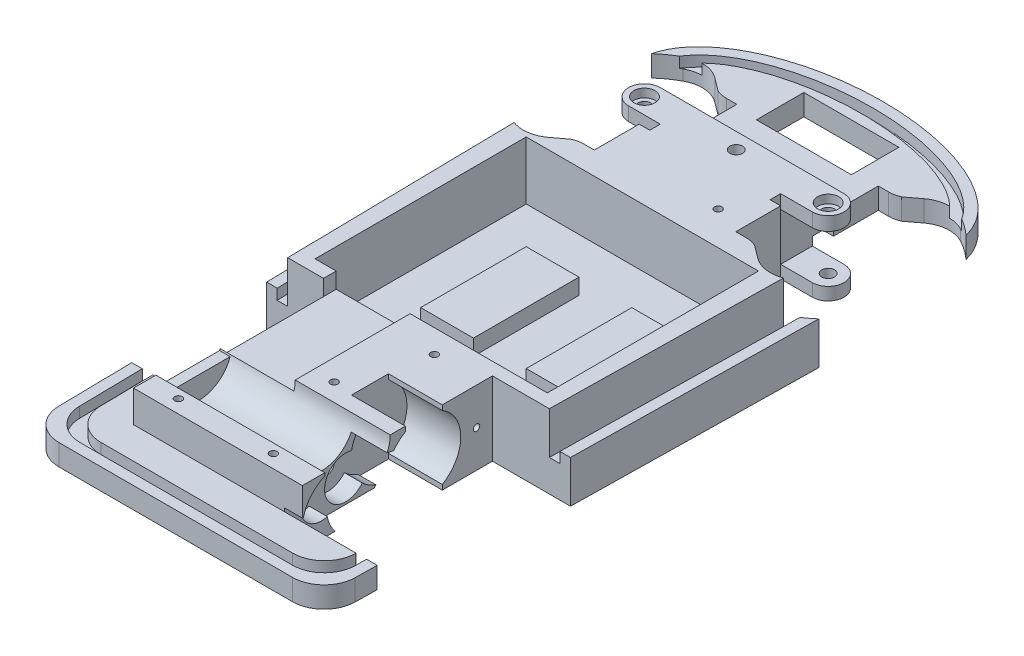
from build123d import *
from build123d.topology import SkipClean

# Parameters (mm, degrees)
SKETCH_1_RX               = 15
SKETCH_1_RY               = 8
EXTRUDE_1_DEPTH           = 2
FILLET_1_R                = 3
CUT_EXTRUDE_1_DEPTH       = 69.687699069
SKETCH_3_R                = 0.6
CUT_EXTRUDE_2_DEPTH       = 72.196910082
SKETCH_4_W                = 6
SKETCH_4_H                = 13
CUT_EXTRUDE_3_DEPTH       = 69.687699069
EXTRUDE_START             = -3.5
SKETCH_5_W                = 11
SKETCH_5_H                = 13
SKETCH_5_W_2              = 1
EXTRUDE_2_DEPTH           = 5
SKETCH_6_R                = 1.25
CUT_EXTRUDE_4_DEPTH       = 72.254824432
EXTRUDE_START_2           = 3
SKETCH_8_W                = 11
SKETCH_8_H                = 4
EXTRUDE_4_DEPTH           = 8
CUT_EXTRUDE_6_REACH       = 73.344
SKETCH_10_R               = 3.1
CUT_EXTRUDE_START         = -17
SKETCH_11_W               = 9
SKETCH_11_H               = 4
CUT_EXTRUDE_7_DEPTH       = 17
EXTRUDE_START_3           = -2.8
EXTRUDE_5_DEPTH           = 0.4
EXTRUDE_START_4           = -7.8
EXTRUDE_6_DEPTH           = 0.4
SKETCH_14_R               = 0.6
CUT_EXTRUDE_8_DEPTH       = 69.84039514
CUT_EXTRUDE_9_DEPTH       = 69.84039514
FILLET_3_R                = 2.5
FILLET_4_R                = 3
SKETCH_16_R               = 0.6
SKETCH_16_W               = 2
SKETCH_16_H               = 1
SKETCH_16_W_2             = 1
CUT_EXTRUDE_10_DEPTH      = 69.81610203
EXTRUDE_7_DEPTH           = 3
EXTRUDE_7_DEPTH_BACK      = 5
SKETCH_16_3_W             = 11.4
SKETCH_16_3_H             = 3
SKETCH_16_3_R             = 0.6
EXTRUDE_START_5           = 0.8
SKETCH_16_4_R             = 0.6
EXTRUDE_8_DEPTH           = 2.2
EXTRUDE_START_6           = -5
SKETCH_16_5_R             = 0.6
EXTRUDE_9_DEPTH           = 1.3
CUT_EXTRUDE_START_2       = 2
CUT_EXTRUDE_12_DEPTH      = 1
FILLET_5_R                = 3
EXTRUDE_START_7           = 1.5
EXTRUDE_10_DEPTH          = 1.5
EXTRUDE_11_DEPTH          = 1.5
EXTRUDE_12_DEPTH          = 2
SKETCH_19_W               = 22
SKETCH_19_H               = 20
CUT_EXTRUDE_13_DEPTH      = 4
SKETCH_21_R               = 0.5
SKETCH_21_W               = 5
SKETCH_21_H               = 10
CUT_EXTRUDE_14_DEPTH      = 1.5
SKETCH_26_W               = 9
SKETCH_26_H               = 4.5
CUT_EXTRUDE_18_DEPTH      = 69.81610203
SKETCH_30_W               = 4.4
SKETCH_30_H               = 1.086541276
SKETCH_30_H_2             = 1
CUT_EXTRUDE_22_DEPTH      = 69.750679259
CUT_EXTRUDE_START_3       = -1.5
CUT_EXTRUDE_23_DEPTH      = 1.5
SKETCH_32_W               = 7
SKETCH_32_H               = 13
EXTRUDE_13_DEPTH          = 7
SKETCH_32_3_W             = 11
SKETCH_32_3_H             = 9
EXTRUDE_14_DEPTH          = 5.5
EXTRUDE_START_8           = -9
EXTRUDE_15_DEPTH          = 17
EXTRUDE_16_DEPTH          = 3
CUT_EXTRUDE_24_DEPTH      = 54.937147668
CUT_EXTRUDE_24_DEPTH_BACK = 54.937147668
SKETCH_33_W               = 29.563747264
SKETCH_33_H               = 3
SKETCH_34_R               = 0.75
CUT_EXTRUDE_25_DEPTH      = 72.306675189
SKETCH_38_R               = 0.35
CUT_EXTRUDE_35_DEPTH      = 3
SKETCH_40_R               = 1
CUT_EXTRUDE_37_DEPTH      = 0.8
SKETCH_36_R               = 3.1
CUT_EXTRUDE_38_DEPTH      = 17
SKETCH_36_16_R            = 0.6
CUT_EXTRUDE_39_DEPTH      = 10
SKETCH_36_17_R            = 0.6
CUT_EXTRUDE_40_DEPTH      = 10
SKETCH_36_20_W            = 2.120465053
SKETCH_36_20_H            = 7
SKETCH_36_20_W_2          = 15.879534947
CUT_EXTRUDE_41_DEPTH      = 7.1
EXTRUDE_START_9           = -5.4
SKETCH_36_23_R            = 0.6
EXTRUDE_21_DEPTH          = 1.7
EXTRUDE_START_10          = -3.7
EXTRUDE_24_DEPTH          = 1.7
SKETCH_36_33_W            = 2.120465053
SKETCH_36_33_H            = 7
SKETCH_36_33_W_2          = 15.879534947
CUT_EXTRUDE_43_DEPTH      = 72.306675189
EXTRUDE_29_DEPTH          = 1.7
CUT_EXTRUDE_44_DEPTH      = 71.977924041
SKETCH_28_R               = 0.35
CUT_EXTRUDE_45_DEPTH      = 69.990259447
SKETCH_42_W               = 7
SKETCH_42_H               = 11
CUT_EXTRUDE_46_DEPTH      = 1.5
SKETCH_43_R               = 0.3
CUT_EXTRUDE_47_DEPTH      = 4


with BuildPart() as part:
    # 草图1 → 凸台-拉伸1 (new body)
    with BuildSketch(Plane(origin=(0, 0, 0), x_dir=(1, 0, 0), z_dir=(0, 1, 0))):
        with Locations(Location((0, -8), (0, 0, 180))):
            Ellipse(SKETCH_1_RX, SKETCH_1_RY)
        Polygon((-15, -8), (15, -8), (14, -67), (-14, -67), align=None)
    extrude(amount=EXTRUDE_1_DEPTH)

    # 圆角1
    fillet_1_edges = [part.edges().sort_by_distance(p)[0] for p in [
        (-14, 1, 67),
        (14, 1, 67),
    ]]
    fillet(fillet_1_edges, radius=FILLET_1_R)

    # 草图2 → 切除-拉伸1 (cut, through all)
    with BuildSketch(Plane(origin=(0, 2, 0), x_dir=(1, 0, 0), z_dir=(0, 1, 0))):
        Polygon((-9, -57), (-9, -44), (-14.389830508, -44), (-14.169491525, -57), align=None)
        Polygon((14.389830508, -44), (9, -44), (9, -57), (14.169491525, -57), align=None)
    extrude(amount=-CUT_EXTRUDE_1_DEPTH, mode=Mode.SUBTRACT)

    # 草图3 → 切除-拉伸2 (cut, through all)
    with BuildSketch(Plane.ZY.offset(9)):
        with Locations((50.5, 1)):
            Circle(SKETCH_3_R)
    extrude(amount=-CUT_EXTRUDE_2_DEPTH, mode=Mode.SUBTRACT)

    # 草图4 → 切除-拉伸3 (cut, through all)
    with BuildSketch(Plane(origin=(0, 2, 0), x_dir=(1, 0, 0), z_dir=(0, 1, 0))):
        with Locations((5, -50.5)):
            Rectangle(SKETCH_4_W, SKETCH_4_H)
    extrude(amount=-CUT_EXTRUDE_3_DEPTH, mode=Mode.SUBTRACT)

    # 草图5 → 凸台-拉伸2 (add)
    with BuildSketch(Plane(origin=(0, 2, 0), x_dir=(1, 0, 0), z_dir=(0, 1, 0)).offset(EXTRUDE_START)):
        with Locations((-3.5, -50.5)):
            Rectangle(SKETCH_5_W, SKETCH_5_H)
        with Locations((8.5, -50.5)):
            Rectangle(SKETCH_5_W_2, SKETCH_5_H)
    extrude(amount=EXTRUDE_2_DEPTH)

    # 草图6 → 切除-拉伸4 (cut, through all)
    with BuildSketch(Plane.ZY.offset(9)):
        with Locations((50.5, 1)):
            Circle(SKETCH_6_R)
    extrude(amount=-CUT_EXTRUDE_4_DEPTH, mode=Mode.SUBTRACT)

    # 草图8 → 凸台-拉伸4 (add)
    with BuildSketch(Plane.XZ.offset(EXTRUDE_START_2)):
        Polygon((2, 57), (9, 57), (9, 62), (-9, 62), (-9, 57), align=None)
        with Locations((-3.5, 55)):
            Rectangle(SKETCH_8_W, SKETCH_8_H)
    extrude(amount=-EXTRUDE_4_DEPTH)

    # 切除-拉伸6: up to this face of the body (flat: up to its plane)
    cut_extrude_6_end = Plane(part.part.faces().sort_by_distance((8, 1, 56.860716117))[0])
    # 草图10 → 切除-拉伸6 (cut, up to the picked face)
    with BuildSketch(Plane.ZY.offset(9), mode=Mode.PRIVATE) as cut_extrude_6_sk1:
        with Locations(Location((57, 1, 0), (0, 0, 18.819063369))):
            Circle(SKETCH_10_R)
    cut_extrude_6_tool1 = split(extrude(cut_extrude_6_sk1.sketch, amount=-CUT_EXTRUDE_6_REACH, mode=Mode.PRIVATE), bisect_by=cut_extrude_6_end, keep=Keep.BOTH, mode=Mode.PRIVATE)
    add(cut_extrude_6_tool1.solids().sort_by(Axis((-9, 1, 57), (1, 0, 0)))[0], mode=Mode.SUBTRACT)

    # 草图11 → 切除-拉伸7 (cut)
    with BuildSketch(Plane.ZY.offset(9).offset(CUT_EXTRUDE_START)):
        with Locations((57.5, -1)):
            Rectangle(SKETCH_11_W, SKETCH_11_H)
    extrude(amount=CUT_EXTRUDE_7_DEPTH, mode=Mode.SUBTRACT)

    # 草图12 → 凸台-拉伸5 (add)
    with BuildSketch(Plane.ZY.offset(9).offset(EXTRUDE_START_3)):
        with BuildLine():
            ThreePointArc((59.93428015, 2), (56.493180735, 4.058289429), (53.9, 1))
            Line((53.9, 1), (54, 1))
            ThreePointArc((54, 1), (57, 4), (60, 1))
            Line((60, 1), (60.2, 1))
            ThreePointArc((60.2, 1), (60.159680194, 1.506380362), (60.039736831, 2))
            Line((60.039736831, 2), (59.93428015, 2))
        make_face()
    extrude(amount=-EXTRUDE_5_DEPTH)

    # 草图12<3> → 凸台-拉伸6 (add)
    with BuildSketch(Plane.ZY.offset(9).offset(EXTRUDE_START_4)):
        with BuildLine():
            ThreePointArc((54, 1), (57, 4), (60, 1))
            Line((60, 1), (60.2, 1))
            ThreePointArc((60.2, 1), (57, 4.2), (53.8, 1))
            Line((53.8, 1), (54, 1))
        make_face()
    extrude(amount=-EXTRUDE_6_DEPTH)

    # 草图14 → 切除-拉伸8 (cut, through all)
    with BuildSketch(Plane(origin=(0, 2, 0), x_dir=(1, 0, 0), z_dir=(0, 1, 0))):
        with Locations(Location((0, -13.9, 0), (0, 0, 270))):
            Circle(SKETCH_14_R)
        with Locations(Location((-8.7, -13.9, 0), (0, 0, 270))):
            Circle(SKETCH_14_R)
        with Locations(Location((8.7, -13.9, 0), (0, 0, 270))):
            Circle(SKETCH_14_R)
    extrude(amount=-CUT_EXTRUDE_8_DEPTH, mode=Mode.SUBTRACT)

    # 草图15 → 切除-拉伸9 (cut, through all)
    with BuildSketch(Plane(origin=(0, 2, 0), x_dir=(1, 0, 0), z_dir=(0, 1, 0))):
        with BuildLine():
            Line((-8.7, -7.15), (-8.7, -4.65))
            ThreePointArc((-8.7, -4.65), (-17.95, -13.9), (-8.7, -23.15))
            Line((-8.7, -23.15), (-8.7, -20.65))
            Line((-8.7, -20.65), (-6.7, -20.65))
            Line((-6.7, -20.65), (-6.7, -15.4))
            Line((-6.7, -15.4), (-8.7, -15.4))
            ThreePointArc((-8.7, -15.4), (-10.2, -13.9), (-8.7, -12.4))
            Line((-8.7, -12.4), (-6.7, -12.4))
            Line((-6.7, -12.4), (-6.7, -7.15))
            Line((-6.7, -7.15), (-8.7, -7.15))
        make_face()
        with BuildLine():
            Line((8.7, -4.65), (8.7, -7.15))
            Line((8.7, -7.15), (6.7, -7.15))
            Line((6.7, -7.15), (6.7, -12.4))
            Line((6.7, -12.4), (8.7, -12.4))
            ThreePointArc((8.7, -12.4), (10.2, -13.899999995), (8.700000009, -15.4))
            Line((8.700000009, -15.4), (6.7, -15.4))
            Line((6.7, -15.4), (6.7, -20.65))
            Line((6.7, -20.65), (8.7, -20.65))
            Line((8.7, -20.65), (8.7, -23.15))
            ThreePointArc((8.7, -23.15), (17.95, -13.9), (8.7, -4.65))
        make_face()
    extrude(amount=-CUT_EXTRUDE_9_DEPTH, mode=Mode.SUBTRACT)

    # Chamfer 2
    # the kernel refuses this chamfer: 2 mm, written as the material it adds along each edge
    with BuildSketch(Plane(origin=(-8.7, 2, 4.65), x_dir=(0, 0, 1), z_dir=(0, -1, 0)), Plane(origin=(8.7, 2, 23.15), x_dir=(0, 0, -1), z_dir=(0, -1, 0))) as chamfer_2_piece_1:
        with BuildLine():
            Line((2.329457801, -0.063896468), (0.31078787, 2.615620606))
            Line((0.31078787, 2.615620606), (0.272339981, 2.626655089))
            ThreePointArc((0.272339981, 2.626655089), (0.054587771, 1.322306295), (-0.04, 0))
            Line((-0.04, 0), (0, -0.04))
            ThreePointArc((0, -0.04), (1.164728901, -0.04), (2.329457801, -0.103896468))
            Line((2.329457801, -0.103896468), (2.329457801, -0.063896468))
        make_face()
    extrude(amount=2)
    with BuildSketch(Plane(origin=(-8.7, 2, 23.15), x_dir=(-0.9902517942555952, 0, -0.13928885085883316), z_dir=(0, -1, 0)), Plane(origin=(8.7, 2, 4.65), x_dir=(0.9902517942555955, 0, 0.13928885085883175), z_dir=(0, -1, 0))) as chamfer_2_piece_2:
        with BuildLine():
            Line((2.633412283, -0.056568542), (0.261193908, 2.315649833))
            Line((0.261193908, 2.315649833), (0.221583836, 2.321221387))
            ThreePointArc((0.221583836, 2.321221387), (0.122623678, 1.158946438), (-0.039610072, 0.005571554))
            Line((-0.039610072, 0.005571554), (-0.005571554, -0.039610072))
            ThreePointArc((-0.005571554, -0.039610072), (1.317019649, -0.130126886), (2.638983837, -0.096178614))
            Line((2.638983837, -0.096178614), (2.633412283, -0.056568542))
        make_face()
    extrude(amount=2)

    # 圆角3
    # the kernel refuses this fillet: 2.5 mm, written as the material it takes off along each edge
    with BuildSketch(Plane(origin=(-8.7, 4.556338628, 7.15), x_dir=(1, 0, 0), z_dir=(0, -1, 0)), Plane(origin=(8.7, 4.556338628, 20.65), x_dir=(-1, 0, 0), z_dir=(0, -1, 0))) as fillet_3_piece_1:
        with BuildLine():
            CenterArc((1.022535451, -2.5), FILLET_3_R, 90, 24.142922194)
            Line((0, -0.218679932), (0, 0))
            Line((0, 0), (1.022535451, 0))
        make_face()
    extrude(amount=7.112677256, mode=Mode.SUBTRACT)
    with BuildSketch(Plane(origin=(-8.7, 4.556338628, 20.65), x_dir=(0, 0, 1), z_dir=(0, -1, 0)), Plane(origin=(8.7, 4.556338628, 7.15), x_dir=(0, 0, -1), z_dir=(0, -1, 0))) as fillet_3_piece_2:
        with BuildLine():
            CenterArc((2.5, -1.022535451), FILLET_3_R, 155.857077806, 24.142922194)
            Line((0, -1.022535451), (0, 0))
            Line((0, 0), (0.218679932, 0))
        make_face()
    extrude(amount=7.112677256, mode=Mode.SUBTRACT)

    # 圆角4
    fillet_4_edges = [part.edges().sort_by_distance(p)[0] for p in [
        (11.251724138, 1, 5.008925604),
        (11.251724138, 1, 22.791074396),
        (-11.251724138, 1, 22.791074396),
        (-11.251724138, 1, 5.008925604),
    ]]
    fillet(fillet_4_edges, radius=FILLET_4_R)

    # 草图16 → 切除-拉伸10 (cut, through all)
    with SkipClean():  # the faces are left unmerged after this step: merging them gives an invalid solid
        with BuildSketch(Plane.XZ):
            with Locations((-8.7, 13.9)):
                Circle(SKETCH_16_R)
            with BuildLine():
                Line((-8.7, 15.4), (-8.7, 12.4))
                ThreePointArc((-8.7, 12.4), (-10.2, 13.9), (-8.7, 15.4))
            make_face()
            with BuildLine():
                ThreePointArc((-8.1, 13.9), (-8.275735931, 14.324264069), (-8.7, 14.5))
                Line((-8.7, 14.5), (-8.7, 13.3))
                ThreePointArc((-8.7, 13.3), (-8.275735931, 13.475735931), (-8.1, 13.9))
            make_face()
            with BuildLine():
                Line((-8.7, 13.3), (-8.7, 14.5))
                ThreePointArc((-8.7, 14.5), (-9.3, 13.9), (-8.7, 13.3))
            make_face()
            with BuildLine():
                ThreePointArc((-7.2, 13.9), (-7.639339828, 14.960660172), (-8.7, 15.4))
                Line((-8.7, 15.4), (-8.7, 14.5))
                ThreePointArc((-8.7, 14.5), (-8.275735931, 14.324264069), (-8.1, 13.9))
                ThreePointArc((-8.1, 13.9), (-8.275735931, 13.475735931), (-8.7, 13.3))
                Line((-8.7, 13.3), (-8.7, 12.4))
                ThreePointArc((-8.7, 12.4), (-7.639339828, 12.839339828), (-7.2, 13.9))
            make_face()
            with BuildLine():
                Line((-8.7, 14.5), (-8.7, 15.4))
                ThreePointArc((-8.7, 15.4), (-10.2, 13.9), (-8.7, 12.4))
                Line((-8.7, 12.4), (-8.7, 13.3))
                ThreePointArc((-8.7, 13.3), (-9.3, 13.9), (-8.7, 14.5))
            make_face()
            with Locations((-7.7, 15.9)):
                Rectangle(SKETCH_16_W, SKETCH_16_H)
            with Locations((-6.2, 15.9)):
                Rectangle(SKETCH_16_W_2, SKETCH_16_H)
            with BuildLine():
                Line((-6.7, 15.4), (-8.7, 15.4))
                ThreePointArc((-8.7, 15.4), (-7.639339828, 14.960660172), (-7.2, 13.9))
                ThreePointArc((-7.2, 13.9), (-7.639339828, 12.839339828), (-8.7, 12.4))
                Line((-8.7, 12.4), (-6.7, 12.4))
                Line((-6.7, 12.4), (-5.7, 12.4))
                Line((-5.7, 12.4), (-5.7, 15.4))
                Line((-5.7, 15.4), (-6.7, 15.4))
            make_face()
            with Locations((-6.2, 11.9)):
                Rectangle(SKETCH_16_W_2, SKETCH_16_H)
            with Locations((-7.7, 11.9)):
                Rectangle(SKETCH_16_W, SKETCH_16_H)
            with Locations((7.7, 15.9)):
                Rectangle(SKETCH_16_W, SKETCH_16_H)
            with Locations((6.2, 15.9)):
                Rectangle(SKETCH_16_W_2, SKETCH_16_H)
            with BuildLine():
                Line((6.7, 15.4), (5.7, 15.4))
                Line((5.7, 15.4), (5.7, 12.4))
                Line((5.7, 12.4), (6.7, 12.4))
                Line((6.7, 12.4), (8.7, 12.4))
                ThreePointArc((8.7, 12.4), (7.2, 13.9), (8.7, 15.4))
                Line((8.7, 15.4), (6.7, 15.4))
            make_face()
            with Locations((6.2, 11.9)):
                Rectangle(SKETCH_16_W_2, SKETCH_16_H)
            with Locations((7.7, 11.9)):
                Rectangle(SKETCH_16_W, SKETCH_16_H)
            with BuildLine():
                ThreePointArc((10.2, 13.9), (9.760660172, 14.960660172), (8.7, 15.4))
                Line((8.7, 15.4), (8.7, 14.5))
                ThreePointArc((8.7, 14.5), (9.124264069, 14.324264069), (9.3, 13.9))
                ThreePointArc((9.3, 13.9), (9.124264069, 13.475735931), (8.7, 13.3))
                Line((8.7, 13.3), (8.7, 12.4))
                ThreePointArc((8.7, 12.4), (9.760660172, 12.839339828), (10.2, 13.9))
            make_face()
            with BuildLine():
                Line((8.7, 14.5), (8.7, 15.4))
                ThreePointArc((8.7, 15.4), (7.2, 13.9), (8.7, 12.4))
                Line((8.7, 12.4), (8.7, 13.3))
                ThreePointArc((8.7, 13.3), (8.1, 13.9), (8.7, 14.5))
            make_face()
            with BuildLine():
                ThreePointArc((9.3, 13.9), (9.124264069, 14.324264069), (8.7, 14.5))
                Line((8.7, 14.5), (8.7, 13.3))
                ThreePointArc((8.7, 13.3), (9.124264069, 13.475735931), (9.3, 13.9))
            make_face()
            with BuildLine():
                Line((8.7, 13.3), (8.7, 14.5))
                ThreePointArc((8.7, 14.5), (8.1, 13.9), (8.7, 13.3))
            make_face()
            with Locations((8.7, 13.9)):
                Circle(SKETCH_16_R)
            with BuildLine():
                Line((8.7, 15.4), (8.7, 12.4))
                ThreePointArc((8.7, 12.4), (10.2, 13.9), (8.7, 15.4))
            make_face()
        extrude(amount=-CUT_EXTRUDE_10_DEPTH, mode=Mode.SUBTRACT)

    # 草图16<3> → 凸台-拉伸7 (add, two sides: drawn at the far end of the back side and taken through both)
    with SkipClean():  # the faces are left unmerged after this step: merging them gives an invalid solid
        with BuildSketch(Plane.XZ.offset(-EXTRUDE_7_DEPTH_BACK)):
            with Locations((0, 13.9)):
                Rectangle(SKETCH_16_3_W, SKETCH_16_3_H)
            with Locations((0, 13.9)):
                Circle(SKETCH_16_3_R, mode=Mode.SUBTRACT)
        extrude(amount=EXTRUDE_7_DEPTH + EXTRUDE_7_DEPTH_BACK)

    # 草图16<4> → 凸台-拉伸8 (add)
    # profile 1 of 2: a face of its own
    with SkipClean():  # the faces are left unmerged after this step: merging them gives an invalid solid
        with BuildSketch(Plane.XZ.offset(EXTRUDE_START_5)):
            with BuildLine():
                Line((-8.7, 12.4), (-5.7, 12.4))
                Line((-5.7, 12.4), (-5.7, 15.4))
                Line((-5.7, 15.4), (-8.7, 15.4))
                ThreePointArc((-8.7, 15.4), (-10.2, 13.9), (-8.7, 12.4))
            make_face()
            with Locations(Location((-8.7, 13.9, 0), (0, 0, 270))):
                Circle(SKETCH_16_4_R, mode=Mode.SUBTRACT)
        # profile 2 of 2: a face of its own
        with BuildSketch(Plane.XZ.offset(EXTRUDE_START_5)):
            with BuildLine():
                Line((8.7, 15.4), (5.7, 15.4))
                Line((5.7, 15.4), (5.7, 12.4))
                Line((5.7, 12.4), (8.7, 12.4))
                ThreePointArc((8.7, 12.4), (10.2, 13.9), (8.7, 15.4))
            make_face()
            with Locations(Location((8.7, 13.9, 0), (0, 0, 270))):
                Circle(SKETCH_16_4_R, mode=Mode.SUBTRACT)
        extrude(amount=EXTRUDE_8_DEPTH)

    # 草图16<5> → 凸台-拉伸9 (add)
    # profile 1 of 2: a face of its own
    with SkipClean():  # the faces are left unmerged after this step: merging them gives an invalid solid
        with BuildSketch(Plane.XZ.offset(EXTRUDE_START_6)):
            with BuildLine():
                Line((-8.7, 12.4), (-5.7, 12.4))
                Line((-5.7, 12.4), (-5.7, 15.4))
                Line((-5.7, 15.4), (-8.7, 15.4))
                ThreePointArc((-8.7, 15.4), (-10.2, 13.9), (-8.7, 12.4))
            make_face()
            with Locations(Location((-8.7, 13.9, 0), (0, 0, 270))):
                Circle(SKETCH_16_5_R, mode=Mode.SUBTRACT)
        # profile 2 of 2: a face of its own
        with BuildSketch(Plane.XZ.offset(EXTRUDE_START_6)):
            with BuildLine():
                Line((8.7, 15.4), (5.7, 15.4))
                Line((5.7, 15.4), (5.7, 12.4))
                Line((5.7, 12.4), (8.7, 12.4))
                ThreePointArc((8.7, 12.4), (10.2, 13.9), (8.7, 15.4))
            make_face()
            with Locations(Location((8.7, 13.9, 0), (0, 0, 270))):
                Circle(SKETCH_16_5_R, mode=Mode.SUBTRACT)
        extrude(amount=EXTRUDE_9_DEPTH)

    # 草图1<6> → 切除-拉伸12 (cut)
    with SkipClean():  # the faces are left unmerged after this step: merging them gives an invalid solid
        with BuildSketch(Plane(origin=(0, 0, 0), x_dir=(1, 0, 0), z_dir=(0, 1, 0)).offset(CUT_EXTRUDE_START_2)):
            with BuildLine():
                add(Edge.make_bspline(
                    [(-13.9501652, -10.940253215), (-13.521853712, -11.5182851), (-12.931286453, -12.054099249)],
                    knots=[0.376353518, 0.376353518, 0.376353518, 0.531425091, 0.531425091, 0.531425091], degree=2, weights=[1, 0.996995606, 1]))
                Line((-13.9501652, -10.940253215), (-13.016949153, -66))
                Line((-13.016949153, -66), (0, -66))
                Line((0, -66), (0, -65))
                Line((0, -65), (-12.033898305, -65))
                Line((-12.033898305, -65), (-12.931286453, -12.054099249))
            make_face()
            with BuildLine():
                Line((0, -65), (0, -66))
                Line((0, -66), (13.016949153, -66))
                Line((13.016949153, -66), (13.9501652, -10.940253215))
                add(Edge.make_bspline(
                    [(12.931286453, -12.054099249), (13.521853712, -11.5182851), (13.9501652, -10.940253215)],
                    knots=[2.610167562, 2.610167562, 2.610167562, 2.765239136, 2.765239136, 2.765239136], degree=2, weights=[1, 0.996995606, 1]))
                Line((12.931286453, -12.054099249), (12.033898305, -65))
                Line((12.033898305, -65), (0, -65))
            make_face()
            with BuildLine():
                Line((13.9501652, -10.940253215), (13.997989228, -8.118635548))
                add(Edge.make_bspline(
                    [(12.955022923, -10.65364754), (13.953357105, -9.435188605), (13.997989228, -8.118635548)],
                    knots=[5.894369902, 5.894369902, 5.894369902, 6.26623656, 6.26623656, 6.26623656], degree=2, weights=[1, 0.98276414, 1]))
                Line((12.955022923, -10.65364754), (12.931286453, -12.054099249))
                add(Edge.make_bspline(
                    [(12.931286453, -12.054099249), (13.521853712, -11.5182851), (13.9501652, -10.940253215)],
                    knots=[2.610167562, 2.610167562, 2.610167562, 2.765239136, 2.765239136, 2.765239136], degree=2, weights=[1, 0.996995606, 1]))
            make_face()
            with BuildLine():
                Line((13.997989228, -8.118635548), (14, -8))
                Line((14, -8), (13, -8))
                add(Edge.make_bspline(
                    [(12.998409043, -8.093866485), (13, -8.046936115), (13, -8)],
                    knots=[6.267540255, 6.267540255, 6.267540255, 6.283185307, 6.283185307, 6.283185307], degree=2, weights=[1, 0.999969404, 1]))
                Line((12.998409043, -8.093866485), (12.955022923, -10.65364754))
                add(Edge.make_bspline(
                    [(12.955022923, -10.65364754), (13.953357105, -9.435188605), (13.997989228, -8.118635548)],
                    knots=[5.894369902, 5.894369902, 5.894369902, 6.26623656, 6.26623656, 6.26623656], degree=2, weights=[1, 0.98276414, 1]))
            make_face()
            with BuildLine():
                add(Edge.make_bspline(
                    [(0, -1), (-14, -1), (-14, -8)],
                    knots=[1.570796327, 1.570796327, 1.570796327, 3.141592654, 3.141592654, 3.141592654], degree=2, weights=[1, 0.707106781, 1]))
                Line((-14, -8), (-13, -8))
                add(Edge.make_bspline(
                    [(0, -2), (-13, -2), (-13, -8)],
                    knots=[1.570796327, 1.570796327, 1.570796327, 3.141592654, 3.141592654, 3.141592654], degree=2, weights=[1, 0.707106781, 1]))
                Line((0, -2), (0, -1))
            make_face()
            with BuildLine():
                add(Edge.make_bspline(
                    [(14, -8), (14, -1), (0, -1)],
                    knots=[0, 0, 0, 1.570796327, 1.570796327, 1.570796327], degree=2, weights=[1, 0.707106781, 1]))
                Line((0, -1), (0, -2))
                add(Edge.make_bspline(
                    [(13, -8), (13, -2), (0, -2)],
                    knots=[0, 0, 0, 1.570796327, 1.570796327, 1.570796327], degree=2, weights=[1, 0.707106781, 1]))
                Line((13, -8), (14, -8))
            make_face()
            with BuildLine():
                Line((-13, -8), (-14, -8))
                Line((-14, -8), (-13.997989228, -8.118635548))
                add(Edge.make_bspline(
                    [(-13.997989228, -8.118635548), (-13.953357105, -9.435188605), (-12.955022923, -10.65364754)],
                    knots=[3.1585414, 3.1585414, 3.1585414, 3.530408058, 3.530408058, 3.530408058], degree=2, weights=[1, 0.98276414, 1]))
                Line((-12.955022923, -10.65364754), (-12.998409043, -8.093866485))
                add(Edge.make_bspline(
                    [(-13, -8), (-13, -8.046936115), (-12.998409043, -8.093866485)],
                    knots=[3.141592654, 3.141592654, 3.141592654, 3.157237706, 3.157237706, 3.157237706], degree=2, weights=[1, 0.999969404, 1]))
            make_face()
            with BuildLine():
                add(Edge.make_bspline(
                    [(-13.997989228, -8.118635548), (-13.953357105, -9.435188605), (-12.955022923, -10.65364754)],
                    knots=[3.1585414, 3.1585414, 3.1585414, 3.530408058, 3.530408058, 3.530408058], degree=2, weights=[1, 0.98276414, 1]))
                Line((-13.997989228, -8.118635548), (-13.9501652, -10.940253215))
                add(Edge.make_bspline(
                    [(-13.9501652, -10.940253215), (-13.521853712, -11.5182851), (-12.931286453, -12.054099249)],
                    knots=[0.376353518, 0.376353518, 0.376353518, 0.531425091, 0.531425091, 0.531425091], degree=2, weights=[1, 0.996995606, 1]))
                Line((-12.931286453, -12.054099249), (-12.955022923, -10.65364754))
            make_face()
        extrude(amount=-CUT_EXTRUDE_12_DEPTH, mode=Mode.SUBTRACT)

    # 圆角5
    fillet_5_edges = [part.edges().sort_by_distance(p)[0] for p in [
        (-13.016949153, 1.5, 66),
        (12.033898305, 1.5, 65),
        (13.016949153, 1.5, 66),
        (-12.033898305, 1.5, 65),
    ]]
    fillet(fillet_5_edges, radius=FILLET_5_R)

    # 草图17 → 凸台-拉伸10 (add)
    with SkipClean():  # the faces are left unmerged after this step: merging them gives an invalid solid
        with BuildSketch(Plane(origin=(0, 2, 0), x_dir=(1, 0, 0), z_dir=(0, 1, 0)).offset(EXTRUDE_START_7)):
            with BuildLine():
                Line((8, -44), (9, -44))
                Line((9, -44), (12.389830508, -44))
                Line((12.389830508, -44), (12.759521181, -22.188250328))
                ThreePointArc((12.759521181, -22.188250328), (11.278098241, -22.347687368), (9.9026815, -21.774745061))
                Line((9.9026815, -21.774745061), (8.7, -20.868679932))
                ThreePointArc((8.7, -20.868679932), (8.200293312, -20.705281185), (7.677464549, -20.65))
                Line((7.677464549, -20.65), (6.7, -20.65))
                Line((6.7, -20.65), (6.7, -16.4))
                Line((6.7, -16.4), (5.7, -16.4))
                Line((5.7, -16.4), (5.7, -15.4))
                Line((5.7, -15.4), (-5.7, -15.4))
                Line((-5.7, -15.4), (-5.7, -16.4))
                Line((-5.7, -16.4), (-6.7, -16.4))
                Line((-6.7, -16.4), (-6.7, -20.65))
                Line((-6.7, -20.65), (-7.677464549, -20.65))
                ThreePointArc((-7.677464549, -20.65), (-8.200293312, -20.705281185), (-8.7, -20.868679932))
                Line((-8.7, -20.868679932), (-9.9026815, -21.774745061))
                ThreePointArc((-9.9026815, -21.774745061), (-11.278098241, -22.347687368), (-12.759521181, -22.188250328))
                Line((-12.759521181, -22.188250328), (-12.389830508, -44))
                Line((-12.389830508, -44), (-9, -44))
                Line((-9, -44), (2, -44))
                Line((2, -44), (8, -44))
            make_face()
        extrude(amount=-EXTRUDE_10_DEPTH)

    # 草图18 → 凸台-拉伸11 (add)
    with BuildSketch(Plane(origin=(0, 3.5, 0), x_dir=(1, 0, 0), z_dir=(0, 1, 0)).offset(EXTRUDE_START_7)):
        with BuildLine():
            Line((-9, -44), (-9, -53))
            Line((-9, -53), (2, -53))
            Line((2, -53), (2, -44))
            Line((2, -44), (8, -44))
            Line((8, -44), (8, -57))
            Line((8, -57), (9, -57))
            Line((9, -57), (9, -44))
            Line((9, -44), (12.389830508, -44))
            Line((12.389830508, -44), (12.759521181, -22.188250328))
            ThreePointArc((12.759521181, -22.188250328), (11.278098241, -22.347687368), (9.9026815, -21.774745061))
            Line((9.9026815, -21.774745061), (8.7, -20.868679932))
            ThreePointArc((8.7, -20.868679932), (8.200293312, -20.705281185), (7.677464549, -20.65))
            Line((7.677464549, -20.65), (6.7, -20.65))
            Line((6.7, -20.65), (6.7, -16.4))
            Line((6.7, -16.4), (5.7, -16.4))
            Line((5.7, -16.4), (5.7, -15.4))
            Line((5.7, -15.4), (-5.7, -15.4))
            Line((-5.7, -15.4), (-5.7, -16.4))
            Line((-5.7, -16.4), (-6.7, -16.4))
            Line((-6.7, -16.4), (-6.7, -20.65))
            Line((-6.7, -20.65), (-7.677464549, -20.65))
            ThreePointArc((-7.677464549, -20.65), (-8.200293312, -20.705281185), (-8.7, -20.868679932))
            Line((-8.7, -20.868679932), (-9.9026815, -21.774745061))
            ThreePointArc((-9.9026815, -21.774745061), (-11.278098241, -22.347687368), (-12.759521181, -22.188250328))
            Line((-12.759521181, -22.188250328), (-12.389830508, -44))
            Line((-12.389830508, -44), (-9, -44))
        make_face()
    extrude(amount=-EXTRUDE_11_DEPTH)

    # 草图22 → 凸台-拉伸12 (add)
    with BuildSketch(Plane.XZ):
        with BuildLine():
            Line((-5.7, 15.4), (5.7, 15.4))
            Line((5.7, 15.4), (5.7, 16.4))
            Line((5.7, 16.4), (6.7, 16.4))
            Line((6.7, 16.4), (6.7, 20.65))
            Line((6.7, 20.65), (7.677464549, 20.65))
            ThreePointArc((7.677464549, 20.65), (8.200293312, 20.705281185), (8.7, 20.868679932))
            Line((8.7, 20.868679932), (9.9026815, 21.774745061))
            ThreePointArc((9.9026815, 21.774745061), (11.492678535, 22.370901353), (13.151612826, 22.008368717))
            ThreePointArc((13.151612826, 22.008368717), (13.99743947, 21.482851381), (14.781873632, 20.869455727))
            Line((14.781873632, 20.869455727), (14.389830508, 44))
            Line((14.389830508, 44), (9, 44))
            Line((9, 44), (8, 44))
            Line((8, 44), (2, 44))
            Line((2, 44), (-9, 44))
            Line((-9, 44), (-14.389830508, 44))
            Line((-14.389830508, 44), (-14.781873632, 20.869455727))
            ThreePointArc((-14.781873632, 20.869455727), (-13.99743947, 21.482851381), (-13.151612826, 22.008368717))
            ThreePointArc((-13.151612826, 22.008368717), (-11.492678535, 22.370901353), (-9.9026815, 21.774745061))
            Line((-9.9026815, 21.774745061), (-8.7, 20.868679932))
            ThreePointArc((-8.7, 20.868679932), (-8.200293312, 20.705281185), (-7.677464549, 20.65))
            Line((-7.677464549, 20.65), (-6.7, 20.65))
            Line((-6.7, 20.65), (-6.7, 16.4))
            Line((-6.7, 16.4), (-5.7, 16.4))
            Line((-5.7, 16.4), (-5.7, 15.4))
        make_face()
    extrude(amount=EXTRUDE_12_DEPTH)

    # 草图19 → 切除-拉伸13 (cut)
    with BuildSketch(Plane(origin=(0, 5, 0), x_dir=(1, 0, 0), z_dir=(0, 1, 0))):
        with Locations((0, -32.8)):
            Rectangle(SKETCH_19_W, SKETCH_19_H)
    extrude(amount=-CUT_EXTRUDE_13_DEPTH, mode=Mode.SUBTRACT)

    # 草图21 → 切除-拉伸14 (cut)
    with BuildSketch(Plane(origin=(0, 1, 0), x_dir=(1, 0, 0), z_dir=(0, 1, 0))):
        Polygon((-11, -42.8), (7.463556508, -42.8), (7.463556508, -37.8), (4, -37.8), (-1, -37.8), (-6, -37.8), (-11, -37.8), align=None)
        Polygon((-11, -22.8), (-11, -37.8), (-6, -37.8), (-6, -27.8), (-6, -22.8), align=None)
        Polygon((4, -27.8), (11, -27.8), (11, -22.8), (-6, -22.8), (-6, -27.8), (-1, -27.8), align=None)
        with Locations(Location((8.963556508, -35.448222914, 0), (0, 0, 270))):
            Circle(SKETCH_21_R)
        with Locations(Location((8.963556508, -40.344583971, 0), (0, 0, 270))):
            Circle(SKETCH_21_R)
        with Locations((1.5, -32.8)):
            Rectangle(SKETCH_21_W, SKETCH_21_H)
    extrude(amount=-CUT_EXTRUDE_14_DEPTH, mode=Mode.SUBTRACT)

    # 草图26 → 切除-拉伸18 (cut, through all)
    with BuildSketch(Plane.XZ):
        with Locations((0, 5.25)):
            Rectangle(SKETCH_26_W, SKETCH_26_H)
    extrude(amount=-CUT_EXTRUDE_18_DEPTH, mode=Mode.SUBTRACT)

    # 草图30 → 切除-拉伸22 (cut, through all)
    with BuildSketch(Plane(origin=(0, 1, 0), x_dir=(1, 0, 0), z_dir=(0, 1, 0))):
        with Locations((0, -1.543270638)):
            Rectangle(SKETCH_30_W, SKETCH_30_H)
        with Locations((0, -65.5)):
            Rectangle(SKETCH_30_W, SKETCH_30_H_2)
    extrude(amount=-CUT_EXTRUDE_22_DEPTH, mode=Mode.SUBTRACT)

    # 切除-拉伸23: read off the stored shape, not the designer's step
    # 切除-拉伸23 outline → 切除-拉伸23 (cut)
    with BuildSketch(Plane(origin=(0, 5, 0), x_dir=(1, 0, 0), z_dir=(0, 1, 0)).offset(CUT_EXTRUDE_START_3)):
        Polygon((-9, -53.8), (-2, -53.8), (-2, -42.8), (-5, -42.8), (-5, -45.3), (-9, -45.3), (-9, -48.3), (-5, -48.3), (-5, -51.8), (-9, -51.8), align=None)
    extrude(amount=CUT_EXTRUDE_23_DEPTH, mode=Mode.SUBTRACT)

    # 草图32 → 凸台-拉伸13 (add)
    with BuildSketch(Plane.XZ.offset(2)):
        with Locations((5.5, 50.5)):
            Rectangle(SKETCH_32_W, SKETCH_32_H)
    extrude(amount=-EXTRUDE_13_DEPTH)

    # 草图32<3> → 凸台-拉伸14 (add)
    with BuildSketch(Plane.XZ.offset(2)):
        with Locations((-3.5, 48.5)):
            Rectangle(SKETCH_32_3_W, SKETCH_32_3_H)
    extrude(amount=-EXTRUDE_14_DEPTH)

    # 凸台-拉伸15: read off the stored shape, not the designer's step
    # 凸台-拉伸15 outline → 凸台-拉伸15 (add)
    with BuildSketch(Plane.YZ.offset(EXTRUDE_START_8)):
        with BuildLine():
            ThreePointArc((1, 60.1), (-0.895893272, 59.452669709), (-2, 57.781024968))
            Line((-2, 57.781024968), (-2, 56.218975032))
            ThreePointArc((-2, 56.218975032), (-0.895893272, 54.547330291), (1, 53.9))
            ThreePointArc((1, 53.9), (4.1, 57), (1, 60.1))
        make_face()
    extrude(amount=EXTRUDE_15_DEPTH)

    # 草图32<5> → 凸台-拉伸16 (add)
    with BuildSketch(Plane.XZ.offset(2)):
        Polygon((2, 53), (2, 57), (8, 57), (8, 62), (-9, 62), (-9, 53), align=None)
    extrude(amount=-EXTRUDE_16_DEPTH)

    # 草图33 → 切除-拉伸24 (cut, two sides: drawn at the far end of the back side and taken through both)
    with BuildSketch(Plane.XY.offset(15.4).offset(-CUT_EXTRUDE_24_DEPTH_BACK)):
        with Locations((0, -3.5)):
            Rectangle(SKETCH_33_W, SKETCH_33_H)
    extrude(amount=CUT_EXTRUDE_24_DEPTH + CUT_EXTRUDE_24_DEPTH_BACK, mode=Mode.SUBTRACT)

    # 草图34 → 切除-拉伸25 (cut, through all)
    with BuildSketch(Plane(origin=(9, 0, 0), x_dir=(0, 0, -1), z_dir=(1, 0, 0))):
        with Locations((-50.5, 1.5)):
            Circle(SKETCH_34_R)
    extrude(amount=-CUT_EXTRUDE_25_DEPTH, mode=Mode.SUBTRACT)

    # 草图38 → 切除-拉伸35 (cut)
    with BuildSketch(Plane(origin=(0, -2, 0), x_dir=(-1, 0, 0), z_dir=(0, -1, 0))):
        with Locations(Location((0, -52, 0), (0, 0, 90))):
            Circle(SKETCH_38_R)
    extrude(amount=-CUT_EXTRUDE_35_DEPTH, mode=Mode.SUBTRACT)

    # 草图40 → 切除-拉伸37 (cut)
    with BuildSketch(Plane(origin=(0, 5, 0), x_dir=(1, 0, 0), z_dir=(0, 1, 0))):
        with Locations(Location((8.7, -13.9, 0), (0, 0, 270))):
            Circle(SKETCH_40_R)
        with Locations(Location((-8.7, -13.9, 0), (0, 0, 270))):
            Circle(SKETCH_40_R)
    extrude(amount=-CUT_EXTRUDE_37_DEPTH, mode=Mode.SUBTRACT)

    # 草图36 → 切除-拉伸38 (cut)
    with BuildSketch(Plane(origin=(9, 0, 0), x_dir=(0, 0, -1), z_dir=(1, 0, 0))):
        with Locations((-56.779534947, 5)):
            Circle(SKETCH_36_R)
    extrude(amount=-CUT_EXTRUDE_38_DEPTH, mode=Mode.SUBTRACT)

    # 草图36<16> → 切除-拉伸39 (cut)
    with BuildSketch(Plane(origin=(9, 0, 0), x_dir=(0, 0, -1), z_dir=(1, 0, 0))):
        with Locations((-54.5, 0.219375153)):
            Circle(SKETCH_36_16_R)
    extrude(amount=-CUT_EXTRUDE_39_DEPTH, mode=Mode.SUBTRACT)

    # 草图36<17> → 切除-拉伸40 (cut)
    with BuildSketch(Plane(origin=(9, 0, 0), x_dir=(0, 0, -1), z_dir=(1, 0, 0))):
        with Locations((-58.5, 1.5)):
            Circle(SKETCH_36_17_R)
    extrude(amount=-CUT_EXTRUDE_40_DEPTH, mode=Mode.SUBTRACT)

    # 草图36<20> → 切除-拉伸41 (cut)
    with BuildSketch(Plane(origin=(9, 0, 0), x_dir=(0, 0, -1), z_dir=(1, 0, 0))):
        with Locations((-60.939767474, 1.5)):
            Rectangle(SKETCH_36_20_W, SKETCH_36_20_H)
        with Locations((-51.939767473, 1.5)):
            Rectangle(SKETCH_36_20_W_2, SKETCH_36_20_H)
    extrude(amount=-CUT_EXTRUDE_41_DEPTH, mode=Mode.SUBTRACT)

    # 草图36<23> → 凸台-拉伸21 (add)
    # profile 1 of 2: a face of its own
    with BuildSketch(Plane(origin=(9, 0, 0), x_dir=(0, 0, -1), z_dir=(1, 0, 0)).offset(EXTRUDE_START_9)):
        with BuildLine():
            ThreePointArc((-59.867043344, 4.7219858), (-59.87329173, 4.719327542), (-59.879534947, 4.716657167))
            Line((-59.879534947, 4.716657167), (-59.879534947, 5))
            Line((-59.879534947, 5), (-62, 5))
            Line((-62, 5), (-62, -2))
            Line((-62, -2), (-51.793641943, -2))
            ThreePointArc((-51.793641943, -2), (-51.718271331, -1.904768349), (-51.646250102, -1.80697909))
            ThreePointArc((-51.646250102, -1.80697909), (-52.330844164, -1.482953175), (-52.929700643, -1.019236945))
            ThreePointArc((-52.929700643, -1.019236945), (-56.404761905, -0.390446203), (-53.941047657, 2.139680409))
            ThreePointArc((-53.941047657, 2.139680409), (-53.357700579, 3.520778909), (-52.25, 4.531088913))
            Line((-52.25, 4.531088913), (-52.25, 5))
            Line((-52.25, 5), (-53.679534947, 5))
            ThreePointArc((-53.679534947, 5), (-56.640387601, 1.903124475), (-59.867043344, 4.7219858))
        make_face()
        with Locations((-58.5, 1.5)):
            Circle(SKETCH_36_23_R, mode=Mode.SUBTRACT)
    # profile 2 of 2: a face of its own
    with BuildSketch(Plane(origin=(9, 0, 0), x_dir=(0, 0, -1), z_dir=(1, 0, 0)).offset(EXTRUDE_START_9)):
        with BuildLine():
            Line((-44, 5), (-48.75, 5))
            Line((-48.75, 5), (-48.75, 4.531088913))
            ThreePointArc((-48.75, 4.531088913), (-47, 1.5), (-48.75, -1.531088913))
            Line((-48.75, -1.531088913), (-48.75, -2))
            Line((-48.75, -2), (-44, -2))
            Line((-44, -2), (-44, 5))
        make_face()
    extrude(amount=-EXTRUDE_21_DEPTH)

    # 草图36<27> → 凸台-拉伸24 (add)
    with BuildSketch(Plane(origin=(9, 0, 0), x_dir=(0, 0, -1), z_dir=(1, 0, 0)).offset(EXTRUDE_START_10)):
        with BuildLine():
            Line((-59.879534947, 4.716657167), (-59.879534947, 5))
            Line((-59.879534947, 5), (-62, 5))
            Line((-62, 5), (-62, -2))
            Line((-62, -2), (-57.206358057, -2))
            ThreePointArc((-57.206358057, -2), (-57.673563946, -1.256596351), (-57.941047657, -0.420305256))
            ThreePointArc((-57.941047657, -0.420305256), (-58.935957376, -0.451907059), (-59.822875656, 0))
            Line((-59.822875656, 0), (-59.879534947, 0))
            Line((-59.879534947, 0), (-59.879534947, 0.051938078))
            ThreePointArc((-59.879534947, 0.051938078), (-60.476004633, 1.808878115), (-59.371818827, 3.299981093))
            ThreePointArc((-59.371818827, 3.299981093), (-59.707082457, 3.980458155), (-59.867043344, 4.7219858))
            ThreePointArc((-59.867043344, 4.7219858), (-59.87329173, 4.719327542), (-59.879534947, 4.716657167))
        make_face()
        with BuildLine():
            Line((-52.25, 5), (-53.679534947, 5))
            ThreePointArc((-53.679534947, 5), (-53.754234974, 4.32356813), (-53.974734994, 3.679735925))
            ThreePointArc((-53.974734994, 3.679735925), (-53.660731167, 3.61726094), (-53.353749898, 3.526354243))
            ThreePointArc((-53.353749898, 3.526354243), (-52.856056286, 4.088242411), (-52.25, 4.531088913))
            Line((-52.25, 4.531088913), (-52.25, 5))
        make_face()
        with BuildLine():
            Line((-44, 5), (-48.75, 5))
            Line((-48.75, 5), (-48.75, 4.531088913))
            ThreePointArc((-48.75, 4.531088913), (-47, 1.5), (-48.75, -1.531088913))
            Line((-48.75, -1.531088913), (-48.75, -2))
            Line((-48.75, -2), (-44, -2))
            Line((-44, -2), (-44, 5))
        make_face()
    extrude(amount=-EXTRUDE_24_DEPTH)

    # 草图36<33> → 切除-拉伸43 (cut, through all)
    with BuildSketch(Plane(origin=(9, 0, 0), x_dir=(0, 0, -1), z_dir=(1, 0, 0))):
        with Locations((-60.939767474, 1.5)):
            Rectangle(SKETCH_36_33_W, SKETCH_36_33_H)
        with Locations((-51.939767473, 1.5)):
            Rectangle(SKETCH_36_33_W_2, SKETCH_36_33_H)
    extrude(amount=CUT_EXTRUDE_43_DEPTH, mode=Mode.SUBTRACT)

    # 草图36<30> → 凸台-拉伸29 (add)
    with BuildSketch(Plane(origin=(9, 0, 0), x_dir=(0, 0, -1), z_dir=(1, 0, 0)).offset(EXTRUDE_START_10)):
        with BuildLine():
            Line((-59.879534947, 4.716657167), (-59.879534947, 5))
            Line((-59.879534947, 5), (-62, 5))
            Line((-62, 5), (-62, 2.330662386))
            Line((-62, 2.330662386), (-61.9, 2.330662386))
            ThreePointArc((-61.9, 2.330662386), (-61.170998194, 3.761806501), (-59.879534947, 4.716657167))
        make_face()
        with BuildLine():
            Line((-59.879534947, -2), (-59.879534947, -1.716657167))
            ThreePointArc((-59.879534947, -1.716657167), (-60.876984335, -1.069035903), (-61.6, -0.124807681))
            Line((-61.6, -0.124807681), (-62, -0.124807681))
            Line((-62, -0.124807681), (-62, -2))
            Line((-62, -2), (-59.879534947, -2))
        make_face()
        with BuildLine():
            Line((-44, 5), (-48.75, 5))
            Line((-48.75, 5), (-48.75, 4.531088913))
            ThreePointArc((-48.75, 4.531088913), (-47.468911087, 3.25), (-47, 1.5))
            ThreePointArc((-47, 1.5), (-47.468911087, -0.25), (-48.75, -1.531088913))
            Line((-48.75, -1.531088913), (-48.75, -2))
            Line((-48.75, -2), (-44, -2))
            Line((-44, -2), (-44, 5))
        make_face()
        with BuildLine():
            Line((-52.25, 5), (-53.679534947, 5))
            ThreePointArc((-53.679534947, 5), (-53.754234974, 4.32356813), (-53.974734994, 3.679735925))
            ThreePointArc((-53.974734994, 3.679735925), (-53.660731167, 3.61726094), (-53.353749898, 3.526354243))
            ThreePointArc((-53.353749898, 3.526354243), (-52.856056286, 4.088242411), (-52.25, 4.531088913))
            Line((-52.25, 4.531088913), (-52.25, 5))
        make_face()
    extrude(amount=EXTRUDE_29_DEPTH)

    # 草图41 → 切除-拉伸44 (cut, through all)
    with SkipClean():  # the faces are left unmerged after this step: merging them gives an invalid solid
        with BuildSketch(Plane(origin=(-8, 0, 0), x_dir=(0, 0, -1), z_dir=(1, 0, 0))):
            with BuildLine():
                Line((-53.8, 5), (-59.879534947, 5))
                ThreePointArc((-59.879534947, 5), (-59.837824376, 4.493180735), (-59.713815097, 4))
                Line((-59.713815097, 4), (-53.845254796, 4))
                ThreePointArc((-53.845254796, 4), (-53.821748343, 4.071830615), (-53.8, 4.144212934))
                Line((-53.8, 4.144212934), (-53.8, 5))
            make_face()
        extrude(amount=-CUT_EXTRUDE_44_DEPTH, mode=Mode.SUBTRACT)

    # 草图28 → 切除-拉伸45 (cut, through all)
    with SkipClean():  # the faces are left unmerged after this step: merging them gives an invalid solid
        with BuildSketch(Plane(origin=(0, 5, 0), x_dir=(1, 0, 0), z_dir=(0, 1, 0))):
            with Locations(Location((4, -19.619341954, 0), (0, 0, 270))):
                Circle(SKETCH_28_R)
            with Locations(Location((-6, -60.75, 0), (0, 0, 270))):
                Circle(SKETCH_28_R)
            with Locations(Location((3, -60.75, 0), (0, 0, 270))):
                Circle(SKETCH_28_R)
            with Locations(Location((0, -52, 0), (0, 0, 90))):
                Circle(SKETCH_28_R)
            with Locations(Location((2.5, -45, 0), (0, 0, 270))):
                Circle(SKETCH_28_R)
        extrude(amount=-CUT_EXTRUDE_45_DEPTH, mode=Mode.SUBTRACT)

    # 草图42 → 切除-拉伸46 (cut)
    with SkipClean():  # the faces are left unmerged after this step: merging them gives an invalid solid
        with BuildSketch(Plane(origin=(0, 5, 0), x_dir=(1, 0, 0), z_dir=(0, 1, 0))):
            with Locations((-5.5, -48.3)):
                Rectangle(SKETCH_42_W, SKETCH_42_H)
        extrude(amount=-CUT_EXTRUDE_46_DEPTH, mode=Mode.SUBTRACT)

    # 草图43 → 切除-拉伸47 (cut)
    with SkipClean():  # the faces are left unmerged after this step: merging them gives an invalid solid
        with BuildSketch(Plane(origin=(7, 0, 0), x_dir=(0, 0, -1), z_dir=(1, 0, 0))):
            with Locations((-45.5, 1.5)):
                Circle(SKETCH_43_R)
        extrude(amount=-CUT_EXTRUDE_47_DEPTH, mode=Mode.SUBTRACT)


solid = part.part
